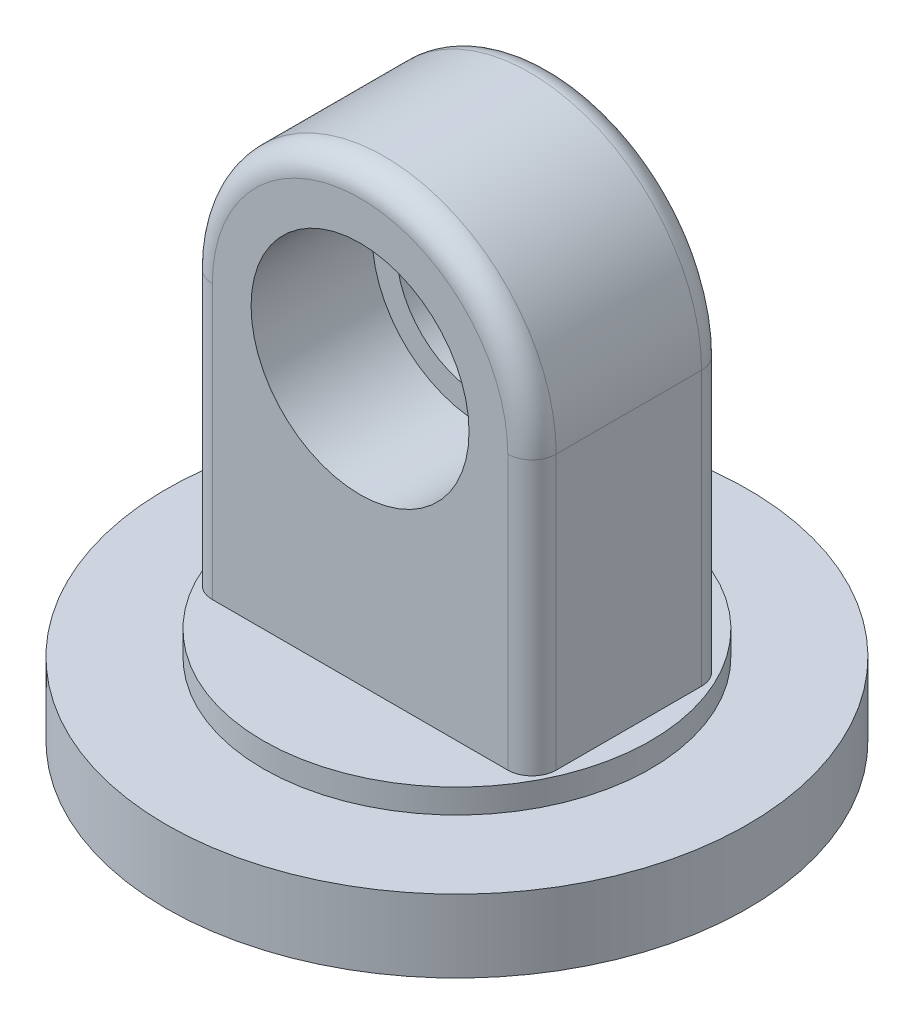
from build123d import *

# Parameters (mm, degrees)
SKETCH_1_R          = 6
EXTRUDE_1_DEPTH     = 1.5
SKETCH_2_R          = 4
EXTRUDE_2_DEPTH     = 0.5
SKETCH_3_R          = 4.5
EXTRUDE_3_DEPTH     = 0.5
SKETCH_4_R          = 3.5
CUT_EXTRUDE_1_DEPTH = 0.5
SKETCH_8_R          = 1.75
EXTRUDE_5_DEPTH     = 2
SKETCH_9_R          = 2.25
CUT_EXTRUDE_3_DEPTH = 2.5
FILLET_1_R          = 0.5
SKETCH_5_R          = 1.2
CUT_EXTRUDE_2_DEPTH = 2.4


with BuildPart() as part:
    # ｽｹｯﾁ1 → ﾎﾞｽ - 押し出し1 (new body)
    with BuildSketch(Plane(origin=(0, 0, 0), x_dir=(1, 0, 0), z_dir=(0, 1, 0))):
        with Locations(Location((0, 0, 0), (0, 0, 270))):
            Circle(SKETCH_1_R)
    extrude(amount=EXTRUDE_1_DEPTH)

    # ｽｹｯﾁ2 → ﾎﾞｽ - 押し出し2 (add)
    with BuildSketch(Plane(origin=(0, 1.5, 0), x_dir=(1, 0, 0), z_dir=(0, 1, 0))):
        with Locations(Location((0, 0, 0), (0, 0, 270))):
            Circle(SKETCH_2_R)
    extrude(amount=EXTRUDE_2_DEPTH)

    # ｽｹｯﾁ3 → ﾎﾞｽ - 押し出し3 (add)
    with BuildSketch(Plane.XZ):
        with Locations(Location((0, 0, 0), (0, 0, 270))):
            Circle(SKETCH_3_R)
    extrude(amount=EXTRUDE_3_DEPTH)

    # ｽｹｯﾁ4 → ｶｯﾄ - 押し出し1 (cut)
    with BuildSketch(Plane.XZ.offset(0.5)):
        with Locations(Location((0, 0, 0), (0, 0, 270))):
            Circle(SKETCH_4_R)
    extrude(amount=-CUT_EXTRUDE_1_DEPTH, mode=Mode.SUBTRACT)

    # ｽｹｯﾁ8 → ﾎﾞｽ - 押し出し5 (add, symmetric)
    with BuildSketch(Plane.XY):
        with BuildLine():
            Line((-3.55, 2), (-3.55, 7.65))
            ThreePointArc((-3.55, 7.65), (0, 11.2), (3.55, 7.65))
            Line((3.55, 7.65), (3.55, 2))
            Line((3.55, 2), (-3.55, 2))
        make_face()
        with Locations((0, 7.65)):
            Circle(SKETCH_8_R, mode=Mode.SUBTRACT)
    extrude(amount=EXTRUDE_5_DEPTH, both=True)

    # ｽｹｯﾁ9 → ｶｯﾄ - 押し出し3 (cut)
    with BuildSketch(Plane.XY.offset(2)):
        with Locations((0, 7.65)):
            Circle(SKETCH_9_R)
    extrude(amount=-CUT_EXTRUDE_3_DEPTH, mode=Mode.SUBTRACT)

    # ﾌｨﾚｯﾄ1
    # the kernel refuses this fillet: 0.5 mm, written as the material it takes off along each edge
    with BuildSketch(Plane(origin=(3.55, 7.65, 2), x_dir=(-1, 0, 0), z_dir=(0, -1, 0)), Plane(origin=(-3.55, 2, 2), x_dir=(1, 0, 0), z_dir=(0, 1, 0)), Plane(origin=(-3.55, 2, -2), x_dir=(0, 0, 1), z_dir=(0, 1, 0))) as fillet_1_piece_1:
        with BuildLine():
            CenterArc((FILLET_1_R, FILLET_1_R), FILLET_1_R, 180, 90)
            Line((0, FILLET_1_R), (0, 0))
            Line((0, 0), (FILLET_1_R, 0))
        make_face()
    extrude(amount=5.65, mode=Mode.SUBTRACT)
    with BuildSketch(Plane(origin=(0, 7.65, 2), x_dir=(-1, 0, 0), z_dir=(0, -1, 0))) as fillet_1_piece_2:
        with BuildLine():
            CenterArc((3.55 - FILLET_1_R, FILLET_1_R), FILLET_1_R, 270, 90)
            Line((3.55, FILLET_1_R), (3.55, 0))
            Line((3.55, 0), (3.55 - FILLET_1_R, 0))
        make_face()
    revolve(axis=Axis((0, 7.65, 2), (0, 0, -1)), revolution_arc=180, mode=Mode.SUBTRACT)
    with BuildSketch(Plane(origin=(3.55, 7.65, -2), x_dir=(-1, 0, 0), z_dir=(0, -1, 0))) as fillet_1_piece_3:
        with BuildLine():
            CenterArc((FILLET_1_R, -FILLET_1_R), FILLET_1_R, 90, 90)
            Line((0, -FILLET_1_R), (0, 0))
            Line((0, 0), (FILLET_1_R, 0))
        make_face()
    extrude(amount=5.65, mode=Mode.SUBTRACT)
    with BuildSketch(Plane(origin=(0, 7.65, -2), x_dir=(-1, 0, 0), z_dir=(0, -1, 0))) as fillet_1_piece_4:
        with BuildLine():
            CenterArc((3.55 - FILLET_1_R, -FILLET_1_R), FILLET_1_R, 0, 90)
            Line((3.55, -FILLET_1_R), (3.55, 0))
            Line((3.55, 0), (3.55 - FILLET_1_R, 0))
        make_face()
    revolve(axis=Axis((0, 7.65, -2), (0, 0, -1)), revolution_arc=180, mode=Mode.SUBTRACT)

    # ｽｹｯﾁ5 → ｶｯﾄ - 押し出し2 (cut)
    with BuildSketch(Plane.XZ):
        with Locations(Location((0, 0, 0), (0, 0, 270))):
            Circle(SKETCH_5_R)
    extrude(amount=-CUT_EXTRUDE_2_DEPTH, mode=Mode.SUBTRACT)


solid = part.part
